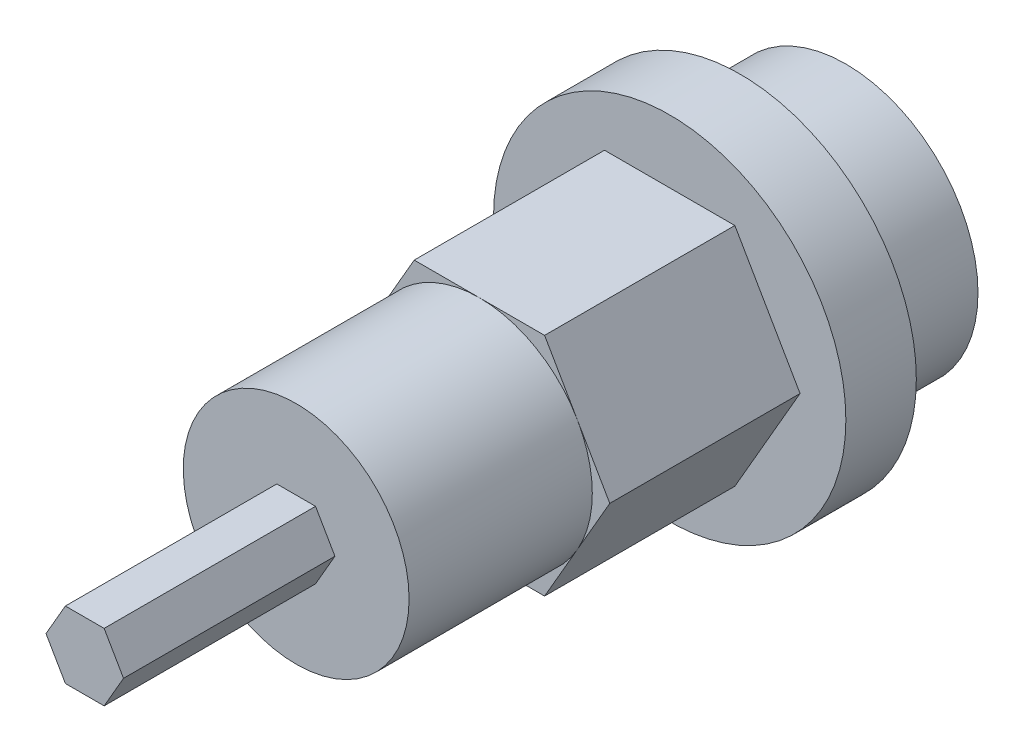
from build123d import *

# Parameters (mm, degrees)
SKETCH1_R           = 3.75
BOSS_EXTRUDE1_DEPTH = 3
SKETCH2_R           = 5
BOSS_EXTRUDE2_DEPTH = 2
BOSS_EXTRUDE3_DEPTH = 5.4
SKETCH4_R           = 3.204293994
BOSS_EXTRUDE4_DEPTH = 5.2
BOSS_EXTRUDE5_DEPTH = 6


with BuildPart() as part:
    # Sketch1 → Boss-Extrude1 (new body)
    with BuildSketch(Plane.XY):
        Circle(SKETCH1_R)
    extrude(amount=BOSS_EXTRUDE1_DEPTH)

    # Sketch2 → Boss-Extrude2 (add)
    with BuildSketch(Plane.XY.offset(3)):
        Circle(SKETCH2_R)
    extrude(amount=BOSS_EXTRUDE2_DEPTH)

    # Sketch3 → Boss-Extrude3 (add)
    with BuildSketch(Plane.XY.offset(5)):
        Polygon((3.7, 0), (1.85, 3.204293994), (-1.85, 3.204293994), (-3.7, 0), (-1.85, -3.204293994), (1.85, -3.204293994), align=None)
    extrude(amount=BOSS_EXTRUDE3_DEPTH)

    # Sketch4 → Boss-Extrude4 (add)
    with BuildSketch(Plane.XY.offset(10.4)):
        Circle(SKETCH4_R)
    extrude(amount=BOSS_EXTRUDE4_DEPTH)

    # Sketch5 → Boss-Extrude5 (add)
    with BuildSketch(Plane.XY.offset(15.6)):
        Polygon((1.1, 0), (0.55, 0.952627944), (-0.55, 0.952627944), (-1.1, 0), (-0.55, -0.952627944), (0.55, -0.952627944), align=None)
    extrude(amount=BOSS_EXTRUDE5_DEPTH)


solid = part.part
